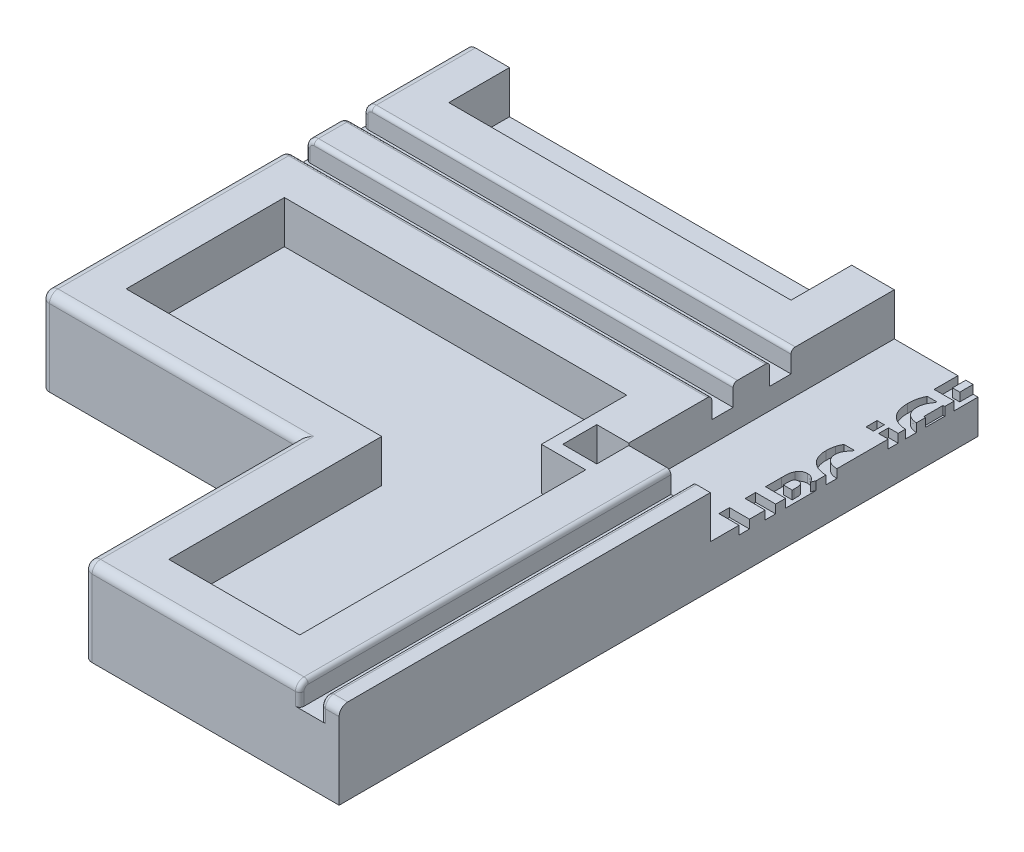
from build123d import *

# Parameters (mm, degrees)
SKETCH1_W                                  = 240
SKETCH1_H                                  = 200
BOSS_EXTRUDE1_DEPTH                        = 20
SKETCH7_W                                  = 120
SKETCH7_H                                  = 50
BOSS_EXTRUDE6_DEPTH                        = 20
FILLET1_R                                  = 2
SKETCH2_W                                  = 39.3
SKETCH2_H                                  = 125.7
CUT_EXTRUDE1_DEPTH                         = 10
CUT_EXTRUDE3_DEPTH                         = 5
MIRROR4_AT_THE_SECOND_PLANE_COPY_1_DEPTH   = 5
SKETCH11_W                                 = 104.748042719
SKETCH11_H                                 = 5
CUT_EXTRUDE4_DEPTH                         = 5
MIRROR6_AT_THE_SECOND_PLANE_COPY_1_SKETC_W = 104.748042719
MIRROR6_AT_THE_SECOND_PLANE_COPY_1_SKETC_H = 5
MIRROR6_AT_THE_SECOND_PLANE_COPY_1_DEPTH   = 5
SHELL1_START                               = 10
SHELL1_OUTLINE_W                           = 80.35
SHELL1_OUTLINE_H                           = 28.5
SHELL1_DEPTH                               = 10
FILLET3_R                                  = 1
SKETCH13_W                                 = 7.252545243
SKETCH13_H                                 = 2.335565418
SKETCH13_W_2                               = 1.720942939
SKETCH13_H_2                               = 2.581414408
CUT_EXTRUDE5_DEPTH                         = 2
CUT_EXTRUDE6_DEPTH                         = 10
MIRROR7_AT_THE_SECOND_PLANE_COPY_1_DEPTH   = 10
SKETCH15_W                                 = 252.845295914
SKETCH15_H                                 = 31.352816693
CUT_EXTRUDE7_DEPTH                         = 194.132079158
SKETCH16_W                                 = 164.349442344
SKETCH16_H                                 = 29.07720903
CUT_EXTRUDE8_DEPTH                         = 194.132079158


# Read off the part's stored shape, not the designer's step: Shell1
with BuildPart() as part:
    # Sketch1 → Boss-Extrude1 (new body)
    with BuildSketch(Plane(origin=(0, 0, 0), x_dir=(1, 0, 0), z_dir=(0, 1, 0))):
        Rectangle(SKETCH1_W, SKETCH1_H)
    extrude(amount=BOSS_EXTRUDE1_DEPTH)

    # Sketch7 → Boss-Extrude6 (add)
    with BuildSketch(Plane(origin=(0, 0, 0), x_dir=(1, 0, 0), z_dir=(0, 1, 0))):
        with Locations((0, 125)):
            Rectangle(SKETCH7_W, SKETCH7_H)
        with Locations((0, -125)):
            Rectangle(SKETCH7_W, SKETCH7_H)
    extrude(amount=BOSS_EXTRUDE6_DEPTH)

    # Fillet1
    fillet1_edges = [part.edges().sort_by_distance(p)[0] for p in [
        (-120, 20, 0),
        (90, 20, 100),
        (-90, 20, 100),
        (-60, 10, 150),
        (60, 10, 150),
        (-60, 20, 125),
        (0, 20, 150),
        (60, 20, 125),
        (-90, 20, -100),
        (60, 20, -125),
        (0, 20, -150),
        (60, 10, -150),
        (-60, 10, -150),
        (-60, 20, -125),
        (120, 20, 0),
        (120, 10, 100),
        (-120, 10, 100),
        (-120, 10, -100),
        (120, 10, -100),
        (90, 20, -100),
    ]]
    fillet(fillet1_edges, radius=FILLET1_R)

    # Sketch2 → Cut-Extrude1 (cut)
    with BuildSketch(Plane(origin=(0, 20, 0), x_dir=(1, 0, 0), z_dir=(0, 1, 0))):
        Rectangle(SKETCH2_W, SKETCH2_H)
    extrude(amount=-CUT_EXTRUDE1_DEPTH, mode=Mode.SUBTRACT)

    # Sketch10 → Cut-Extrude3 (cut)
    with BuildSketch(Plane(origin=(0, 20, 0), x_dir=(1, 0, 0), z_dir=(0, 1, 0))):
        Polygon((-9.25, -40.5), (-9.25, -33.162899401), (-4.25, -33.162899401), (-4.25, -40.5), (-4.25, -156.832928994), (-9.25, -156.832928994), align=None)
    cut_extrude3 = extrude(amount=-CUT_EXTRUDE3_DEPTH, mode=Mode.SUBTRACT)

    # Mirror4: Cut-Extrude3 across plane
    add(cut_extrude3.mirror(Plane(origin=(0, 0, 0), x_dir=(0, 0, 1), z_dir=(1, 0, 0))), mode=Mode.SUBTRACT)

    # Mirror4 at the second plane: Cut-Extrude3 across plane
    add(cut_extrude3.mirror(Plane.XY), mode=Mode.SUBTRACT)

    # Mirror4 at the second plane copy 1 sketc → Mirror4 at the second plane copy 1 (cut)
    with BuildSketch(Plane(origin=(0, 20, 0), x_dir=(-1, 0, 0), z_dir=(0, 1, 0))):
        Polygon((-9.25, -40.5), (-9.25, -33.162899401), (-4.25, -33.162899401), (-4.25, -40.5), (-4.25, -156.832928994), (-9.25, -156.832928994), align=None)
    extrude(amount=-MIRROR4_AT_THE_SECOND_PLANE_COPY_1_DEPTH, mode=Mode.SUBTRACT)

    # Sketch11 → Cut-Extrude4 (cut)
    with BuildSketch(Plane(origin=(0, 20, 0), x_dir=(1, 0, 0), z_dir=(0, 1, 0))):
        with Locations((-72.024021359, 26.75)):
            Rectangle(SKETCH11_W, SKETCH11_H)
        with Locations((-72.024021359, 40.35)):
            Rectangle(SKETCH11_W, SKETCH11_H)
    cut_extrude4 = extrude(amount=-CUT_EXTRUDE4_DEPTH, mode=Mode.SUBTRACT)

    # Mirror6: Cut-Extrude4 across plane
    add(cut_extrude4.mirror(Plane.XY), mode=Mode.SUBTRACT)

    # Mirror6 at the second plane: Cut-Extrude4 across plane
    add(cut_extrude4.mirror(Plane(origin=(0, 0, 0), x_dir=(0, 0, 1), z_dir=(1, 0, 0))), mode=Mode.SUBTRACT)

    # Mirror6 at the second plane copy 1 sketc → Mirror6 at the second plane copy 1 (cut)
    with BuildSketch(Plane(origin=(0, 20, 0), x_dir=(-1, 0, 0), z_dir=(0, 1, 0))):
        with Locations((-72.024021359, 26.75)):
            Rectangle(MIRROR6_AT_THE_SECOND_PLANE_COPY_1_SKETC_W, MIRROR6_AT_THE_SECOND_PLANE_COPY_1_SKETC_H)
        with Locations((-72.024021359, 40.35)):
            Rectangle(MIRROR6_AT_THE_SECOND_PLANE_COPY_1_SKETC_W, MIRROR6_AT_THE_SECOND_PLANE_COPY_1_SKETC_H)
    extrude(amount=-MIRROR6_AT_THE_SECOND_PLANE_COPY_1_DEPTH, mode=Mode.SUBTRACT)

    # Shell1 outline → Shell1 (cut)
    with BuildSketch(Plane(origin=(0, 0, 0), x_dir=(1, 0, 0), z_dir=(0, 1, 0)).offset(SHELL1_START)):
        Polygon((-29.65, 72.85), (-19.25, 72.85), (-19.25, 140), (-50, 140), (-50, 90), (-110, 90), (-110, 52.85), (-29.65, 52.85), align=None)
        Polygon((19.25, 72.85), (29.65, 72.85), (29.65, 52.85), (110, 52.85), (110, 90), (50, 90), (50, 140), (19.25, 140), align=None)
        Polygon((-110, -52.85), (-110, -90), (-50, -90), (-50, -140), (-19.25, -140), (-19.25, -72.85), (-29.65, -72.85), (-29.65, -52.85), align=None)
        with Locations((-69.825, 0)):
            Rectangle(SHELL1_OUTLINE_W, SHELL1_OUTLINE_H)
        Polygon((29.65, -72.85), (19.25, -72.85), (19.25, -140), (50, -140), (50, -90), (110, -90), (110, -52.85), (29.65, -52.85), align=None)
        with Locations((69.825, 0)):
            Rectangle(SHELL1_OUTLINE_W, SHELL1_OUTLINE_H)
    extrude(amount=SHELL1_DEPTH, mode=Mode.SUBTRACT)

    # Fillet3
    fillet3_edges = [part.edges().sort_by_distance(p)[0] for p in [
        (-4.25, 16.5, 150),
        (-4.25, 19.414213562, 149.414213562),
        (-9.25, 16.5, 150),
        (-9.25, 19.414213562, 149.414213562),
        (-4.25, 20, 105.425),
        (-9.25, 20, 105.425),
        (-9.25, 19.414213562, -149.414213562),
        (-9.25, 16.5, -150),
        (-9.25, 20, -105.425),
        (-4.25, 16.5, -150),
        (-4.25, 19.414213562, -149.414213562),
        (-4.25, 20, -105.425),
        (9.25, 16.5, 150),
        (9.25, 20, 105.425),
        (9.25, 19.414213562, 149.414213562),
        (4.25, 16.5, 150),
        (4.25, 19.414213562, 149.414213562),
        (4.25, 20, 105.425),
        (4.25, 16.5, -150),
        (4.25, 19.414213562, -149.414213562),
        (9.25, 19.414213562, -149.414213562),
        (9.25, 16.5, -150),
        (4.25, 20, -105.425),
        (9.25, 20, -105.425),
        (-120, 16.5, -24.25),
        (-120, 16.5, -29.25),
        (-119.414213562, 19.414213562, -24.25),
        (-119.414213562, 19.414213562, -29.25),
        (-68.825, 20, -24.25),
        (-68.825, 20, -29.25),
        (-120, 16.5, -37.85),
        (-120, 16.5, -42.85),
        (-68.825, 20, -37.85),
        (-68.825, 20, -42.85),
        (-119.414213562, 19.414213562, -37.85),
        (-119.414213562, 19.414213562, -42.85),
        (68.825, 20, -29.25),
        (119.414213562, 19.414213562, -29.25),
        (119.414213562, 19.414213562, -24.25),
        (68.825, 20, -24.25),
        (120, 16.5, -29.25),
        (120, 16.5, -24.25),
        (68.825, 20, -42.85),
        (119.414213562, 19.414213562, -42.85),
        (119.414213562, 19.414213562, -37.85),
        (68.825, 20, -37.85),
        (120, 16.5, -42.85),
        (120, 16.5, -37.85),
        (-120, 16.5, 29.25),
        (-120, 16.5, 24.25),
        (-68.825, 20, 29.25),
        (-119.414213562, 19.414213562, 29.25),
        (-119.414213562, 19.414213562, 24.25),
        (-68.825, 20, 24.25),
        (-120, 16.5, 42.85),
        (-120, 16.5, 37.85),
        (-68.825, 20, 42.85),
        (-119.414213562, 19.414213562, 42.85),
        (-119.414213562, 19.414213562, 37.85),
        (-68.825, 20, 37.85),
        (120, 16.5, 24.25),
        (120, 16.5, 29.25),
        (119.414213562, 19.414213562, 24.25),
        (119.414213562, 19.414213562, 29.25),
        (68.825, 20, 24.25),
        (68.825, 20, 29.25),
        (120, 16.5, 37.85),
        (120, 16.5, 42.85),
        (68.825, 20, 37.85),
        (68.825, 20, 42.85),
        (119.414213562, 19.414213562, 37.85),
        (119.414213562, 19.414213562, 42.85),
    ]]
    fillet(fillet3_edges, radius=FILLET3_R)

    # Sketch13 → Cut-Extrude5 (cut)
    # profile 1 of 12: a face of its own
    with BuildSketch(Plane(origin=(0, 10, 0), x_dir=(1, 0, 0), z_dir=(0, 1, 0))):
        Polygon((2.787359078, 56.729654742), (2.787359078, 55.37748529), (5, 55.37748529), (5, 53.041919872), (2.787359078, 53.041919872), (2.787359078, 48.247864542), (0.880108701, 48.247864542), (-4.711035156, 52.886343558), (-4.711035156, 55.37748529), (0.943491644, 55.37748529), (0.943491644, 56.729654742), align=None)
        Polygon((0.943491644, 53.041919872), (-2.596349692, 53.041919872), (0.943491644, 50.110938929), align=None, mode=Mode.SUBTRACT)
    # profile 2 of 12: a face of its own
    with BuildSketch(Plane(origin=(0, 10, 0), x_dir=(1, 0, 0), z_dir=(0, 1, 0))):
        with BuildLine():
            Line((5, 47.141544081), (5, 39.520225351))
            Line((5, 39.520225351), (3.409664338, 39.520225351))
            add(Edge.make_bspline(
                [(3.409664338, 39.520225351), (3.190599668, 39.81675512), (2.747057383, 40.417141716), (2.167094132, 41.14339637), (1.704390868, 41.703253096), (1.381972101, 42.083056551), (1.083256561, 42.417759603), (0.887687077, 42.622007507), (0.79559811, 42.718182933)],
                knots=[0, 0, 0, 0, 1.605452287, 3.25057426, 4.046675402, 4.768563423, 5.420146126, 6, 6, 6, 6], degree=3))
            add(Edge.make_bspline(
                [(0.79559811, 42.718182933), (0.732570292, 42.782561984), (0.609352585, 42.908421315), (0.423765416, 43.085974145), (0.244476812, 43.249198615), (0.074088064, 43.400664381), (-0.092796487, 43.534082219), (-0.252790737, 43.654099684), (-0.406497488, 43.759962438), (-0.599845109, 43.881290453), (-0.837875375, 44.00401532), (-1.125540586, 44.112139625), (-1.412736444, 44.178491494), (-1.604945873, 44.187117789), (-1.699385013, 44.191356186)],
                knots=[0, 0, 0, 0, 1.090093853, 2.131104457, 3.107135244, 4.023908394, 4.888948297, 5.691514549, 6.4435893, 7.146498757, 8.452673016, 9.675803408, 10.85804184, 12, 12, 12, 12], degree=3))
            add(Edge.make_bspline(
                [(-1.699385013, 44.191356186), (-1.754483363, 44.189605987), (-1.861179083, 44.186216799), (-2.017224671, 44.167846758), (-2.162681909, 44.132103765), (-2.300488192, 44.087839319), (-2.42643972, 44.024206924), (-2.544199113, 43.950411254), (-2.650531499, 43.859818439), (-2.749307162, 43.758726543), (-2.834556733, 43.642742478), (-2.911599654, 43.517157005), (-2.971430142, 43.377241787), (-3.024398474, 43.226819474), (-3.063653395, 43.063897589), (-3.092633036, 42.889340485), (-3.109905835, 42.703165878), (-3.111960528, 42.574807759), (-3.113016713, 42.508827152)],
                knots=[0, 0, 0, 0, 1.058578686, 2.049894692, 3.010224385, 3.931750511, 4.822578239, 5.71281177, 6.594427321, 7.498813824, 8.420995957, 9.353043897, 10.321837571, 11.3367408, 12.413304787, 13.535187771, 14.732999458, 16, 16, 16, 16], degree=3))
            add(Edge.make_bspline(
                [(-3.113016713, 42.508827152), (-3.110052719, 42.405568465), (-3.104041103, 42.196137688), (-3.053985994, 41.878413923), (-2.980602684, 41.552282773), (-2.873221808, 41.222921491), (-2.74714341, 40.895094854), (-2.596251992, 40.578640505), (-2.438170844, 40.269132893), (-2.314289691, 40.074405983), (-2.252545243, 39.977350819)],
                knots=[0, 0, 0, 0, 0.914703558, 1.855215137, 2.844920106, 3.875005138, 4.922433174, 5.955639304, 6.981056277, 8, 8, 8, 8], degree=3))
            Line((-2.252545243, 39.977350819), (-2.252545243, 39.766074342))
            Line((-2.252545243, 39.766074342), (-4.363389317, 39.766074342))
            add(Edge.make_bspline(
                [(-4.363389317, 39.766074342), (-4.396975153, 39.85152697), (-4.470639347, 40.038951181), (-4.568658946, 40.352153969), (-4.66491051, 40.720660415), (-4.763825821, 41.132864511), (-4.849735205, 41.573321973), (-4.910075419, 42.024211578), (-4.95119256, 42.474770211), (-4.954991729, 42.775713815), (-4.956884148, 42.92561802)],
                knots=[0, 0, 0, 0, 0.681686624, 1.495150967, 2.435076171, 3.509887788, 4.642826517, 5.765734475, 6.887081194, 8, 8, 8, 8], degree=3))
            add(Edge.make_bspline(
                [(-4.956884148, 42.92561802), (-4.954912362, 43.072306092), (-4.951074185, 43.357841566), (-4.914531776, 43.772464491), (-4.853049644, 44.160650299), (-4.769612134, 44.521836328), (-4.662431161, 44.856562797), (-4.529987596, 45.163893905), (-4.371768891, 45.443672956), (-4.191325, 45.69718541), (-3.986517109, 45.920499957), (-3.762299213, 46.116633841), (-3.516918106, 46.283180062), (-3.250583577, 46.417510178), (-2.964907945, 46.521931142), (-2.659732708, 46.596780352), (-2.333869778, 46.641015432), (-2.109911454, 46.646854566), (-1.995172081, 46.649846099)],
                knots=[0, 0, 0, 0, 1.302669921, 2.535710425, 3.693104205, 4.791067539, 5.825099944, 6.810730835, 7.758000335, 8.67487823, 9.568447078, 10.443087854, 11.315285082, 12.19521531, 13.085757283, 14.011200708, 14.981089066, 16, 16, 16, 16], degree=3))
            add(Edge.make_bspline(
                [(-1.995172081, 46.649846099), (-1.918295051, 46.648245135), (-1.764899121, 46.645050664), (-1.536586701, 46.623146341), (-1.311198259, 46.589276583), (-1.089189633, 46.538876948), (-0.870129482, 46.472993238), (-0.653296175, 46.39436831), (-0.439122967, 46.302496277), (-0.229338943, 46.193054838), (-0.018163961, 46.072147599), (0.191952814, 45.932794317), (0.405837655, 45.781094454), (0.620958688, 45.614342324), (0.835471411, 45.430057751), (1.055741697, 45.23549192), (1.273520634, 45.021368665), (1.417594688, 44.872241147), (1.490889788, 44.796375188)],
                knots=[0, 0, 0, 0, 0.907170522, 1.810115022, 2.704515666, 3.595334857, 4.494160497, 5.402400165, 6.316123003, 7.242010315, 8.19323076, 9.186549597, 10.215937183, 11.28746875, 12.397107329, 13.552885457, 14.755074217, 16, 16, 16, 16], degree=3))
            add(Edge.make_bspline(
                [(1.490889788, 44.796375188), (1.669671754, 44.600991906), (2.021428479, 44.216571794), (2.422503942, 43.720261203), (2.710127438, 43.347225494), (2.892573427, 43.11547907), (3.035611297, 42.923413887), (3.11966375, 42.809753418), (3.156132565, 42.760438229)],
                knots=[0, 0, 0, 0, 1.811045763, 3.563265038, 4.362127914, 5.033096026, 5.580478129, 6, 6, 6, 6], degree=3))
            Line((3.156132565, 42.760438229), (3.156132565, 47.141544081))
            Line((3.156132565, 47.141544081), (5, 47.141544081))
        make_face()
    # profile 3 of 12: a face of its own
    with BuildSketch(Plane(origin=(0, 10, 0), x_dir=(1, 0, 0), z_dir=(0, 1, 0))):
        with BuildLine():
            add(Edge.make_bspline(
                [(0.138720336, 37.553433421), (0.339837036, 37.551198694), (0.731017162, 37.546852061), (1.301575539, 37.503210957), (1.839727263, 37.435290008), (2.344336806, 37.340402007), (2.812295891, 37.218717557), (3.235819492, 37.059739443), (3.620265586, 36.877229499), (3.845547684, 36.720963882), (3.955141787, 36.64494457)],
                knots=[0, 0, 0, 0, 1.210994604, 2.355433537, 3.443919748, 4.476135166, 5.446013627, 6.351277171, 7.197937607, 8, 8, 8, 8], degree=3))
            add(Edge.make_bspline(
                [(3.955141787, 36.64494457), (4.057367971, 36.5617232), (4.260610648, 36.396265258), (4.524020765, 36.101981434), (4.745368417, 35.772676286), (4.897303004, 35.472877401), (4.999247268, 35.217133399), (5.063592063, 35.011802969), (5.122267484, 34.796985151), (5.167723638, 34.570405454), (5.201934481, 34.333084121), (5.226664862, 34.085073274), (5.242295446, 33.825562266), (5.244648027, 33.648682389), (5.245848991, 33.558387312)],
                knots=[0, 0, 0, 0, 1.363120718, 2.710110989, 4.070537742, 5.460816644, 6.180869889, 6.918733188, 7.687278466, 8.485437086, 9.309407483, 10.168795045, 11.065191617, 12, 12, 12, 12], degree=3))
            add(Edge.make_bspline(
                [(5.245848991, 33.558387312), (5.241905689, 33.384062955), (5.234297073, 33.047703496), (5.173081199, 32.562988904), (5.069699732, 32.118069919), (4.926806373, 31.711596248), (4.739854178, 31.34454147), (4.516760058, 31.013155063), (4.251279595, 30.717979546), (4.045332533, 30.554230832), (3.94169692, 30.471830054)],
                knots=[0, 0, 0, 0, 1.200851745, 2.317047666, 3.359233085, 4.342911255, 5.278031965, 6.189548012, 7.088953741, 8, 8, 8, 8], degree=3))
            add(Edge.make_bspline(
                [(3.94169692, 30.471830054), (3.829424185, 30.3947628), (3.600170882, 30.2373967), (3.214838014, 30.049115343), (2.792701976, 29.89168932), (2.331256748, 29.768085058), (1.834031119, 29.675388633), (1.301418942, 29.61187027), (0.734794995, 29.570336966), (0.344952566, 29.565716964), (0.144482422, 29.563341204)],
                knots=[0, 0, 0, 0, 0.822750793, 1.680001256, 2.58557045, 3.544707477, 4.565467581, 5.642347189, 6.787615291, 8, 8, 8, 8], degree=3))
            add(Edge.make_bspline(
                [(0.144482422, 29.563341204), (-0.061754837, 29.565532126), (-0.459970452, 29.569762495), (-1.036345286, 29.613069323), (-1.570746564, 29.680774054), (-2.065452333, 29.775711056), (-2.521358164, 29.900947264), (-2.938473361, 30.06222162), (-3.323134476, 30.249194002), (-3.55325365, 30.406272972), (-3.666176943, 30.483354226)],
                knots=[0, 0, 0, 0, 1.242237956, 2.39858964, 3.479780431, 4.485821505, 5.430991799, 6.32348679, 7.177307181, 8, 8, 8, 8], degree=3))
            add(Edge.make_bspline(
                [(-3.666176943, 30.483354226), (-3.769193286, 30.566416838), (-3.974708441, 30.732124775), (-4.238285133, 31.029639616), (-4.461065672, 31.362253167), (-4.645070962, 31.729678272), (-4.784115122, 32.135791847), (-4.885860052, 32.577168574), (-4.944671996, 33.056148657), (-4.952723667, 33.387282789), (-4.956884148, 33.558387312)],
                knots=[0, 0, 0, 0, 0.915406887, 1.826214983, 2.74012738, 3.682217607, 4.664024873, 5.706462388, 6.814877053, 8, 8, 8, 8], degree=3))
            add(Edge.make_bspline(
                [(-4.956884148, 33.558387312), (-4.955682618, 33.64868302), (-4.953320425, 33.826203271), (-4.937576888, 34.086978277), (-4.913381513, 34.337057391), (-4.877300412, 34.575699285), (-4.828262853, 34.80214551), (-4.773499009, 35.018778584), (-4.706561244, 35.224310597), (-4.601886899, 35.480626422), (-4.447267393, 35.781827029), (-4.217150947, 36.109134402), (-3.948246131, 36.405401156), (-3.739143401, 36.569659884), (-3.633525124, 36.652627351)],
                knots=[0, 0, 0, 0, 0.927772364, 1.823989051, 2.683453821, 3.508702832, 4.302191287, 5.063276402, 5.803871599, 6.520953588, 7.906777029, 9.27188215, 10.622021304, 12, 12, 12, 12], degree=3))
            add(Edge.make_bspline(
                [(-3.633525124, 36.652627351), (-3.521300204, 36.729189524), (-3.292789343, 36.885084383), (-2.908970475, 37.068290297), (-2.492360426, 37.225455121), (-2.036263275, 37.346342452), (-1.54437137, 37.439204828), (-1.015826808, 37.505677425), (-0.450933502, 37.546286922), (-0.061742996, 37.551003841), (0.138720336, 37.553433421)],
                knots=[0, 0, 0, 0, 0.826423845, 1.682753026, 2.582377666, 3.535958882, 4.552416628, 5.629628825, 6.779074777, 8, 8, 8, 8], degree=3))
        make_face()
        with BuildLine():
            add(Edge.make_bspline(
                [(0.138720336, 35.094943508), (-0.002794049, 35.093990238), (-0.275052116, 35.092156251), (-0.667644343, 35.074004214), (-1.028464631, 35.048543297), (-1.357952356, 35.010483072), (-1.656192237, 34.961169576), (-1.923473104, 34.900935006), (-2.158488294, 34.828227196), (-2.363936988, 34.745989678), (-2.54162794, 34.64913888), (-2.69467252, 34.537908006), (-2.823572221, 34.410664927), (-2.931286275, 34.270097317), (-3.011274034, 34.111739825), (-3.072443859, 33.941187009), (-3.106785969, 33.754382189), (-3.110895684, 33.625106618), (-3.113016713, 33.558387312)],
                knots=[0, 0, 0, 0, 1.684598718, 3.240982106, 4.677870026, 5.990101975, 7.188004416, 8.275163324, 9.249099904, 10.113910365, 10.905306099, 11.652292794, 12.358339015, 13.054983843, 13.750418457, 14.461547751, 15.206002611, 16, 16, 16, 16], degree=3))
            add(Edge.make_bspline(
                [(-3.113016713, 33.558387312), (-3.110895681, 33.491668012), (-3.106785962, 33.362392453), (-3.072443884, 33.175587552), (-3.011273943, 33.005035023), (-2.931286606, 32.84667649), (-2.823570979, 32.706112772), (-2.694677343, 32.578854684), (-2.541608299, 32.467684345), (-2.363496496, 32.37029911), (-2.157013742, 32.289020864), (-1.921590867, 32.215742751), (-1.654258135, 32.155647372), (-1.355414385, 32.106122047), (-1.024612933, 32.068276855), (-0.661244964, 32.04269777), (-0.266085327, 32.024665897), (0.008090715, 32.022799039), (0.150244508, 32.021831116)],
                knots=[0, 0, 0, 0, 0.791766581, 1.534129826, 2.243261137, 2.936741863, 3.631429404, 4.335491923, 5.08037989, 5.869552125, 6.738971147, 7.710171362, 8.794275798, 9.988812621, 11.304907075, 12.745337551, 14.312534512, 16, 16, 16, 16], degree=3))
            add(Edge.make_bspline(
                [(0.150244508, 32.021831116), (0.289201434, 32.022765136), (0.556986265, 32.024565091), (0.943773412, 32.043063349), (1.30096878, 32.067483158), (1.627502144, 32.109075315), (1.924420257, 32.156514098), (2.190195476, 32.220950105), (2.427221865, 32.292197549), (2.635687527, 32.376524358), (2.816464841, 32.475577579), (2.974492505, 32.586386469), (3.106149375, 32.714997304), (3.215613674, 32.855867424), (3.298888327, 33.012083539), (3.358752163, 33.181622444), (3.396338685, 33.365314373), (3.400067537, 33.492898418), (3.401981557, 33.558387312)],
                knots=[0, 0, 0, 0, 1.658832269, 3.196746878, 4.622488866, 5.931787449, 7.125569234, 8.210133994, 9.194149195, 10.078471196, 10.889203548, 11.650697572, 12.375032472, 13.07829054, 13.77251817, 14.478471121, 15.218999177, 16, 16, 16, 16], degree=3))
            add(Edge.make_bspline(
                [(3.401981557, 33.558387312), (3.400068186, 33.623876875), (3.3963406, 33.751462223), (3.358745104, 33.935144911), (3.298913291, 34.10471679), (3.215521541, 34.260812329), (3.106775331, 34.40178813), (2.97377315, 34.528364287), (2.816557237, 34.639341559), (2.635707586, 34.738476019), (2.42683161, 34.821967534), (2.190341985, 34.897522561), (1.921851262, 34.956560743), (1.624132619, 35.009519497), (1.295502071, 35.045529443), (0.936895825, 35.074962985), (0.547988509, 35.091838226), (0.278306115, 35.093884415), (0.138720336, 35.094943508)],
                knots=[0, 0, 0, 0, 0.778971247, 1.517574904, 2.221693305, 2.914116855, 3.615547377, 4.332711038, 5.092226179, 5.900851692, 6.782875619, 7.766611013, 8.854037796, 10.053520173, 11.366075456, 12.788704916, 14.337855446, 16, 16, 16, 16], degree=3))
        make_face(mode=Mode.SUBTRACT)
    # profile 4 of 12: a face of its own
    with BuildSketch(Plane(origin=(0, 10, 0), x_dir=(1, 0, 0), z_dir=(0, 1, 0))):
        with BuildLine():
            Line((5, 28.211171751), (5, 20.589853021))
            Line((5, 20.589853021), (3.409664338, 20.589853021))
            add(Edge.make_bspline(
                [(3.409664338, 20.589853021), (3.190599668, 20.88638279), (2.747057383, 21.486769386), (2.167094132, 22.21302404), (1.704390868, 22.772880767), (1.381972101, 23.152684221), (1.083256561, 23.487387273), (0.887687077, 23.691635177), (0.79559811, 23.787810603)],
                knots=[0, 0, 0, 0, 1.605452287, 3.25057426, 4.046675402, 4.768563423, 5.420146126, 6, 6, 6, 6], degree=3))
            add(Edge.make_bspline(
                [(0.79559811, 23.787810603), (0.732570292, 23.852189654), (0.609352585, 23.978048985), (0.423765416, 24.155601815), (0.244476812, 24.318826285), (0.074088064, 24.470292051), (-0.092796487, 24.60370989), (-0.252790737, 24.723727355), (-0.406497488, 24.829590108), (-0.599845109, 24.950918123), (-0.837875375, 25.07364299), (-1.125540586, 25.181767295), (-1.412736444, 25.248119164), (-1.604945873, 25.256745459), (-1.699385013, 25.260983856)],
                knots=[0, 0, 0, 0, 1.090093853, 2.131104457, 3.107135244, 4.023908394, 4.888948297, 5.691514549, 6.4435893, 7.146498757, 8.452673016, 9.675803408, 10.85804184, 12, 12, 12, 12], degree=3))
            add(Edge.make_bspline(
                [(-1.699385013, 25.260983856), (-1.754483363, 25.259233658), (-1.861179083, 25.25584447), (-2.017224671, 25.237474428), (-2.162681909, 25.201731435), (-2.300488192, 25.157466989), (-2.42643972, 25.093834595), (-2.544199113, 25.020038924), (-2.650531499, 24.929446109), (-2.749307162, 24.828354213), (-2.834556733, 24.712370148), (-2.911599654, 24.586784675), (-2.971430142, 24.446869457), (-3.024398474, 24.296447144), (-3.063653395, 24.133525259), (-3.092633036, 23.958968155), (-3.109905835, 23.772793548), (-3.111960528, 23.644435429), (-3.113016713, 23.578454822)],
                knots=[0, 0, 0, 0, 1.058578686, 2.049894692, 3.010224385, 3.931750511, 4.822578239, 5.71281177, 6.594427321, 7.498813824, 8.420995957, 9.353043897, 10.321837571, 11.3367408, 12.413304787, 13.535187771, 14.732999458, 16, 16, 16, 16], degree=3))
            add(Edge.make_bspline(
                [(-3.113016713, 23.578454822), (-3.110052719, 23.475196136), (-3.104041103, 23.265765358), (-3.053985994, 22.948041593), (-2.980602684, 22.621910443), (-2.873221808, 22.292549161), (-2.74714341, 21.964722525), (-2.596251992, 21.648268175), (-2.438170844, 21.338760563), (-2.314289691, 21.144033653), (-2.252545243, 21.046978489)],
                knots=[0, 0, 0, 0, 0.914703558, 1.855215137, 2.844920106, 3.875005138, 4.922433174, 5.955639304, 6.981056277, 8, 8, 8, 8], degree=3))
            Line((-2.252545243, 21.046978489), (-2.252545243, 20.835702012))
            Line((-2.252545243, 20.835702012), (-4.363389317, 20.835702012))
            add(Edge.make_bspline(
                [(-4.363389317, 20.835702012), (-4.396975153, 20.92115464), (-4.470639347, 21.108578851), (-4.568658946, 21.421781639), (-4.66491051, 21.790288086), (-4.763825821, 22.202492181), (-4.849735205, 22.642949643), (-4.910075419, 23.093839248), (-4.95119256, 23.544397881), (-4.954991729, 23.845341485), (-4.956884148, 23.99524569)],
                knots=[0, 0, 0, 0, 0.681686624, 1.495150967, 2.435076171, 3.509887788, 4.642826517, 5.765734475, 6.887081194, 8, 8, 8, 8], degree=3))
            add(Edge.make_bspline(
                [(-4.956884148, 23.99524569), (-4.954912362, 24.141933762), (-4.951074185, 24.427469237), (-4.914531776, 24.842092162), (-4.853049644, 25.230277969), (-4.769612134, 25.591463998), (-4.662431161, 25.926190468), (-4.529987596, 26.233521576), (-4.371768891, 26.513300626), (-4.191325, 26.76681308), (-3.986517109, 26.990127627), (-3.762299213, 27.186261512), (-3.516918106, 27.352807733), (-3.250583577, 27.487137848), (-2.964907945, 27.591558812), (-2.659732708, 27.666408023), (-2.333869778, 27.710643103), (-2.109911454, 27.716482236), (-1.995172081, 27.719473769)],
                knots=[0, 0, 0, 0, 1.302669921, 2.535710425, 3.693104205, 4.791067539, 5.825099944, 6.810730835, 7.758000335, 8.67487823, 9.568447078, 10.443087854, 11.315285082, 12.19521531, 13.085757283, 14.011200708, 14.981089066, 16, 16, 16, 16], degree=3))
            add(Edge.make_bspline(
                [(-1.995172081, 27.719473769), (-1.918295051, 27.717872805), (-1.764899121, 27.714678334), (-1.536586701, 27.692774011), (-1.311198259, 27.658904253), (-1.089189633, 27.608504619), (-0.870129482, 27.542620908), (-0.653296175, 27.46399598), (-0.439122967, 27.372123947), (-0.229338943, 27.262682508), (-0.018163961, 27.141775269), (0.191952814, 27.002421987), (0.405837655, 26.850722124), (0.620958688, 26.683969994), (0.835471411, 26.499685422), (1.055741697, 26.30511959), (1.273520634, 26.090996335), (1.417594688, 25.941868817), (1.490889788, 25.866002858)],
                knots=[0, 0, 0, 0, 0.907170522, 1.810115022, 2.704515666, 3.595334857, 4.494160497, 5.402400165, 6.316123003, 7.242010315, 8.19323076, 9.186549597, 10.215937183, 11.28746875, 12.397107329, 13.552885457, 14.755074217, 16, 16, 16, 16], degree=3))
            add(Edge.make_bspline(
                [(1.490889788, 25.866002858), (1.669671754, 25.670619576), (2.021428479, 25.286199464), (2.422503942, 24.789888873), (2.710127438, 24.416853164), (2.892573427, 24.18510674), (3.035611297, 23.993041557), (3.11966375, 23.879381088), (3.156132565, 23.830065899)],
                knots=[0, 0, 0, 0, 1.811045763, 3.563265038, 4.362127914, 5.033096026, 5.580478129, 6, 6, 6, 6], degree=3))
            Line((3.156132565, 23.830065899), (3.156132565, 28.211171751))
            Line((3.156132565, 28.211171751), (5, 28.211171751))
        make_face()
    # profile 5 of 12: a face of its own
    with BuildSketch(Plane(origin=(0, 10, 0), x_dir=(1, 0, 0), z_dir=(0, 1, 0))):
        Polygon((5, 13.583156769), (5, 11.124666856), (-1.524601746, 11.124666856), (2.664434583, 9.338420279), (2.664434583, 7.625160121), (-1.524601746, 5.838913543), (5, 5.838913543), (5, 3.503348126), (-4.711035156, 3.503348126), (-4.711035156, 6.382470298), (0.125275469, 8.549014533), (-4.711035156, 10.709796683), (-4.711035156, 13.583156769), align=None)
    # profile 6 of 12: a face of its own
    with BuildSketch(Plane(origin=(0, 10, 0), x_dir=(1, 0, 0), z_dir=(0, 1, 0))):
        Polygon((5, 1.4136317), (5, -5.593064552), (-4.711035156, -5.593064552), (-4.711035156, 1.4136317), (-2.867167722, 1.4136317), (-2.867167722, -3.134574639), (-1.146224782, -3.134574639), (-1.146224782, 1.044858213), (0.697642652, 1.044858213), (0.697642652, -3.134574639), (3.156132565, -3.134574639), (3.156132565, 1.4136317), align=None)
    # profile 7 of 12: a face of its own
    with BuildSketch(Plane(origin=(0, 10, 0), x_dir=(1, 0, 0), z_dir=(0, 1, 0))):
        with BuildLine():
            add(Edge.make_bspline(
                [(4.475650198, -7.805705474), (4.519354839, -7.923859504), (4.612512661, -8.17570855), (4.743574124, -8.583890089), (4.866671289, -9.047274178), (4.996208031, -9.552124696), (5.106381276, -10.084227717), (5.187397941, -10.625264318), (5.237323662, -11.165972628), (5.243010567, -11.526628491), (5.245848991, -11.706637515)],
                knots=[0, 0, 0, 0, 0.756485239, 1.612472169, 2.573171414, 3.635272123, 4.742182008, 5.834553763, 6.919191659, 8, 8, 8, 8], degree=3))
            add(Edge.make_bspline(
                [(5.245848991, -11.706637515), (5.241962961, -11.909112321), (5.234392087, -12.303579456), (5.17063924, -12.878829296), (5.062937634, -13.419584917), (4.916847086, -13.928231287), (4.72267015, -14.400885619), (4.491042888, -14.842463027), (4.211679163, -15.247896521), (3.893490591, -15.618759753), (3.53655883, -15.9505899), (3.145758166, -16.239699566), (2.72146993, -16.48347792), (2.264846611, -16.681095463), (1.776896349, -16.838089964), (1.255150105, -16.944841813), (0.702111097, -17.014888699), (0.322052776, -17.021601157), (0.127196165, -17.025042647)],
                knots=[0, 0, 0, 0, 1.160705024, 2.261318311, 3.313123859, 4.319096107, 5.290496718, 6.238021168, 7.172737693, 8.107230733, 9.03451477, 9.961071912, 10.888559376, 11.833805606, 12.808979065, 13.821966168, 14.883317984, 16, 16, 16, 16], degree=3))
            add(Edge.make_bspline(
                [(0.127196165, -17.025042647), (-0.058682323, -17.02067815), (-0.422730133, -17.012130168), (-0.955049114, -16.943336637), (-1.460067022, -16.832867692), (-1.937766829, -16.677677821), (-2.386372436, -16.473696921), (-2.808700267, -16.227656485), (-3.203463564, -15.935836699), (-3.565000576, -15.598836264), (-3.895700628, -15.226075236), (-4.177610929, -14.810267907), (-4.422741814, -14.363406013), (-4.616779655, -13.8775432), (-4.772219277, -13.359136807), (-4.876169413, -12.804694831), (-4.946971316, -12.216810998), (-4.953520434, -11.812500101), (-4.956884148, -11.604840667)],
                knots=[0, 0, 0, 0, 1.061573339, 2.079118747, 3.060574866, 4.011305467, 4.942696719, 5.870461571, 6.798745348, 7.740825567, 8.68941507, 9.638984161, 10.604583371, 11.595514188, 12.621960228, 13.691449096, 14.814297672, 16, 16, 16, 16], degree=3))
            add(Edge.make_bspline(
                [(-4.956884148, -11.604840667), (-4.954318925, -11.445386322), (-4.949235323, -11.129389392), (-4.919388643, -10.661251886), (-4.863951384, -10.205248288), (-4.792453594, -9.753475749), (-4.684946461, -9.294730481), (-4.534849919, -8.818874824), (-4.346707534, -8.316660693), (-4.193287983, -7.980233106), (-4.113698935, -7.805705474)],
                knots=[0, 0, 0, 0, 0.974479143, 1.931163549, 2.86485946, 3.780778834, 4.725046501, 5.741022375, 6.828116267, 8, 8, 8, 8], degree=3))
            Line((-4.113698935, -7.805705474), (-1.883771756, -7.805705474))
            Line((-1.883771756, -7.805705474), (-1.883771756, -8.091889065))
            add(Edge.make_bspline(
                [(-1.883771756, -8.091889065), (-1.906716104, -8.126531064), (-1.957410079, -8.203070203), (-2.043059993, -8.326945943), (-2.137489474, -8.476111594), (-2.284548962, -8.694884397), (-2.45960062, -8.978067997), (-2.581693909, -9.213466955), (-2.640525683, -9.326896107)],
                knots=[0, 0, 0, 0, 0.515980687, 1.140024195, 1.869947604, 2.707876564, 4.413660046, 6, 6, 6, 6], degree=3))
            add(Edge.make_bspline(
                [(-2.640525683, -9.326896107), (-2.672756546, -9.393740863), (-2.73882048, -9.530753251), (-2.823836627, -9.749019276), (-2.905177649, -9.981830174), (-2.978097, -10.22950925), (-3.037034138, -10.489919732), (-3.082413494, -10.759686706), (-3.106467195, -11.03779789), (-3.110821171, -11.225783758), (-3.113016713, -11.320577771)],
                knots=[0, 0, 0, 0, 0.861448091, 1.765719082, 2.717953576, 3.724891765, 4.761927522, 5.816719679, 6.89905606, 8, 8, 8, 8], degree=3))
            add(Edge.make_bspline(
                [(-3.113016713, -11.320577771), (-3.110164997, -11.430782772), (-3.104578279, -11.646682304), (-3.068710383, -11.963218824), (-3.004292393, -12.263584213), (-2.918860854, -12.549882667), (-2.805175217, -12.820581595), (-2.662381265, -13.075068024), (-2.499039638, -13.320076357), (-2.36711736, -13.466852812), (-2.300562624, -13.540901474)],
                knots=[0, 0, 0, 0, 1.091217493, 2.137773647, 3.148547478, 4.129133693, 5.092188092, 6.048375109, 7.015406034, 8, 8, 8, 8], degree=3))
            add(Edge.make_bspline(
                [(-2.300562624, -13.540901474), (-2.231129169, -13.608753509), (-2.090799964, -13.745886571), (-1.846186727, -13.91943259), (-1.579009792, -14.07619004), (-1.283734201, -14.208811415), (-0.962723927, -14.314570988), (-0.616833633, -14.387928819), (-0.248028071, -14.435679856), (0.006035391, -14.440927383), (0.136799641, -14.443628239)],
                knots=[0, 0, 0, 0, 0.871242595, 1.760833901, 2.686460846, 3.652134751, 4.663748384, 5.717797841, 6.825370436, 8, 8, 8, 8], degree=3))
            add(Edge.make_bspline(
                [(0.136799641, -14.443628239), (0.270078203, -14.441217619), (0.528956778, -14.436535262), (0.904701948, -14.395518364), (1.257245759, -14.329288021), (1.585144219, -14.233472949), (1.889752999, -14.11198958), (2.170660406, -13.964565335), (2.424839249, -13.78559248), (2.657673098, -13.584235453), (2.862193118, -13.352834409), (3.041867765, -13.096983341), (3.191530728, -12.813783401), (3.315763592, -12.506455713), (3.407777269, -12.172177215), (3.477785429, -11.813452581), (3.51753353, -11.428392977), (3.522401475, -11.163169785), (3.524906052, -11.026711399)],
                knots=[0, 0, 0, 0, 1.162877018, 2.258757441, 3.29433279, 4.289818334, 5.235063129, 6.152415668, 7.05144509, 7.94239879, 8.832861761, 9.739671241, 10.664582224, 11.622279774, 12.626959197, 13.685538709, 14.809200461, 16, 16, 16, 16], degree=3))
            add(Edge.make_bspline(
                [(3.524906052, -11.026711399), (3.524545414, -10.976125561), (3.523787414, -10.869802624), (3.51698298, -10.707868976), (3.511542352, -10.544994826), (3.50110347, -10.438303115), (3.496095624, -10.387119882)],
                knots=[0, 0, 0, 0, 0.947728294, 1.991965744, 3.036685378, 4, 4, 4, 4], degree=3))
            Line((3.496095624, -10.387119882), (1.435189626, -10.387119882))
            Line((1.435189626, -10.387119882), (1.435189626, -12.353911813))
            Line((1.435189626, -12.353911813), (-0.408677809, -12.353911813))
            Line((-0.408677809, -12.353911813), (-0.408677809, -7.805705474))
            Line((-0.408677809, -7.805705474), (4.475650198, -7.805705474))
        make_face()
    # profile 8 of 12: a face of its own
    with BuildSketch(Plane(origin=(0, 10, 0), x_dir=(1, 0, 0), z_dir=(0, 1, 0))):
        with Locations((1.373727378, -19.913768295)):
            Rectangle(SKETCH13_W, SKETCH13_H)
    # profile 9 of 12: a face of its own
    with BuildSketch(Plane(origin=(0, 10, 0), x_dir=(1, 0, 0), z_dir=(0, 1, 0))):
        with Locations((-4.219337174, -19.913768295)):
            Rectangle(SKETCH13_W_2, SKETCH13_H_2)
    # profile 10 of 12: a face of its own
    with BuildSketch(Plane(origin=(0, 10, 0), x_dir=(1, 0, 0), z_dir=(0, 1, 0))):
        with BuildLine():
            add(Edge.make_bspline(
                [(5.245848991, -30.773379208), (5.241556228, -30.949600555), (5.233101922, -31.296656552), (5.17328717, -31.807137753), (5.071443943, -32.296870987), (4.929457053, -32.76358831), (4.750483589, -33.205121013), (4.527408056, -33.614715808), (4.267338932, -33.994815031), (4.061606502, -34.220067298), (3.958983177, -34.332427496)],
                knots=[0, 0, 0, 0, 1.089850102, 2.146385891, 3.173869964, 4.179760968, 5.160008291, 6.115072822, 7.059761785, 8, 8, 8, 8], degree=3))
            add(Edge.make_bspline(
                [(3.958983177, -34.332427496), (3.848038568, -34.438295465), (3.624492228, -34.651612698), (3.240912088, -34.92404395), (2.819806379, -35.161121156), (2.440058042, -35.326067869), (2.118408243, -35.437370727), (1.865302565, -35.510926057), (1.602961267, -35.571890876), (1.331038558, -35.621175666), (1.050675199, -35.662875321), (0.76008365, -35.687900337), (0.460358885, -35.70657835), (0.257194686, -35.708560179), (0.154085898, -35.709565986)],
                knots=[0, 0, 0, 0, 1.326589366, 2.672993315, 4.060770367, 5.505883836, 6.25107509, 7.007321983, 7.7873399, 8.582269437, 9.400071632, 10.240855478, 11.107208546, 12, 12, 12, 12], degree=3))
            add(Edge.make_bspline(
                [(0.154085898, -35.709565986), (-0.036260272, -35.705853317), (-0.409159179, -35.698579988), (-0.954067146, -35.631518817), (-1.472101576, -35.524248732), (-1.962272567, -35.375865598), (-2.421254864, -35.182794221), (-2.847342954, -34.951680217), (-3.242424741, -34.683652344), (-3.47520079, -34.471076121), (-3.591269829, -34.365079315)],
                knots=[0, 0, 0, 0, 1.119324668, 2.1928203, 3.223958197, 4.228260008, 5.200520162, 6.147632129, 7.076354466, 8, 8, 8, 8], degree=3))
            add(Edge.make_bspline(
                [(-3.591269829, -34.365079315), (-3.696426816, -34.256022231), (-3.907914238, -34.036691095), (-4.17855444, -33.660997219), (-4.413868173, -33.249571895), (-4.610724175, -32.802820982), (-4.765892728, -32.325941651), (-4.877010675, -31.82562766), (-4.943259501, -31.303347455), (-4.952287649, -30.948354573), (-4.956884148, -30.767617122)],
                knots=[0, 0, 0, 0, 0.919195442, 1.8486482, 2.803167129, 3.793795735, 4.808307604, 5.844199062, 6.902417522, 8, 8, 8, 8], degree=3))
            add(Edge.make_bspline(
                [(-4.956884148, -30.767617122), (-4.956393428, -30.668359933), (-4.955436829, -30.474869682), (-4.94084827, -30.191814102), (-4.921289403, -29.923828157), (-4.879474294, -29.592200908), (-4.814808823, -29.204474119), (-4.7421777, -28.904822537), (-4.707193766, -28.760490591)],
                knots=[0, 0, 0, 0, 0.880714095, 1.716848845, 2.514717796, 3.264532192, 4.682418473, 6, 6, 6, 6], degree=3))
            add(Edge.make_bspline(
                [(-4.707193766, -28.760490591), (-4.664108705, -28.621612355), (-4.581310973, -28.354726269), (-4.434982607, -27.98111963), (-4.28414942, -27.652264541), (-4.186257609, -27.446632632), (-4.140588669, -27.350700282)],
                knots=[0, 0, 0, 0, 1.146660616, 2.203568899, 3.161920647, 4, 4, 4, 4], degree=3))
            Line((-4.140588669, -27.350700282), (-1.760847261, -27.350700282))
            Line((-1.760847261, -27.350700282), (-1.760847261, -27.636883873))
            add(Edge.make_bspline(
                [(-1.760847261, -27.636883873), (-1.789760882, -27.669445598), (-1.850028949, -27.737317837), (-1.943169449, -27.84646079), (-2.044289807, -27.966859077), (-2.193791638, -28.146156267), (-2.382825876, -28.396964235), (-2.52216278, -28.612309765), (-2.594428997, -28.723997382)],
                knots=[0, 0, 0, 0, 0.571444814, 1.191129738, 1.882836886, 2.634784766, 4.254652092, 6, 6, 6, 6], degree=3))
            add(Edge.make_bspline(
                [(-2.594428997, -28.723997382), (-2.664236929, -28.846886536), (-2.805685787, -29.09589163), (-2.943550161, -29.429418426), (-3.032587435, -29.709146116), (-3.077362003, -29.929392289), (-3.107853006, -30.156624515), (-3.111280534, -30.311028434), (-3.113016713, -30.389240159)],
                knots=[0, 0, 0, 0, 1.439173741, 2.916136845, 3.667290802, 4.427345131, 5.203387771, 6, 6, 6, 6], degree=3))
            add(Edge.make_bspline(
                [(-3.113016713, -30.389240159), (-3.110477824, -30.475745648), (-3.105440763, -30.647369353), (-3.07497042, -30.902187581), (-3.020147889, -31.150575186), (-2.946619655, -31.393340851), (-2.845477271, -31.627774464), (-2.718252775, -31.853674636), (-2.562057311, -32.070037457), (-2.439651919, -32.20231689), (-2.377390434, -32.269600803)],
                knots=[0, 0, 0, 0, 1.001598119, 1.9871338, 2.96553644, 3.943152672, 4.919306753, 5.914963555, 6.939446524, 8, 8, 8, 8], degree=3))
            add(Edge.make_bspline(
                [(-2.377390434, -32.269600803), (-2.309583745, -32.332034441), (-2.171025631, -32.45961311), (-1.93152049, -32.625206542), (-1.660665123, -32.770051169), (-1.360441958, -32.900067806), (-1.026703819, -33.004078191), (-0.659549693, -33.075068855), (-0.259970233, -33.119887624), (0.017588233, -33.125326369), (0.161768679, -33.128151577)],
                knots=[0, 0, 0, 0, 0.80388915, 1.642689914, 2.53299325, 3.481872775, 4.4947599, 5.577680681, 6.741702658, 8, 8, 8, 8], degree=3))
            add(Edge.make_bspline(
                [(0.161768679, -33.128151577), (0.311768837, -33.125923628), (0.599876693, -33.121644368), (1.011428999, -33.069407329), (1.386636838, -32.994288328), (1.721395513, -32.879071876), (2.020823568, -32.741957475), (2.287301408, -32.588864868), (2.521133588, -32.418332338), (2.653723475, -32.287257692), (2.71821405, -32.223504117)],
                knots=[0, 0, 0, 0, 1.290334302, 2.478367041, 3.565730986, 4.578276722, 5.517838544, 6.396912514, 7.220272109, 8, 8, 8, 8], degree=3))
            add(Edge.make_bspline(
                [(2.71821405, -32.223504117), (2.776624204, -32.15678903), (2.892154246, -32.024832576), (3.038823686, -31.808811236), (3.156499876, -31.579934787), (3.248205125, -31.341825956), (3.315689405, -31.098752861), (3.366730598, -30.856410279), (3.396189151, -30.615336617), (3.400060024, -30.45525906), (3.401981557, -30.375795292)],
                knots=[0, 0, 0, 0, 1.054325691, 2.085361559, 3.097224921, 4.110091334, 5.115626892, 6.095649915, 7.054665517, 8, 8, 8, 8], degree=3))
            add(Edge.make_bspline(
                [(3.401981557, -30.375795292), (3.399995416, -30.300167635), (3.396010997, -30.148450175), (3.367969377, -29.92183692), (3.324531763, -29.696128902), (3.260202951, -29.473850088), (3.18176618, -29.256712893), (3.091757836, -29.045457401), (2.985752349, -28.843934907), (2.905928292, -28.715220777), (2.866107583, -28.651010962)],
                knots=[0, 0, 0, 0, 0.991289386, 1.988636345, 2.989438367, 4.001683697, 5.01851186, 6.01479875, 7.009670459, 8, 8, 8, 8], degree=3))
            add(Edge.make_bspline(
                [(2.866107583, -28.651010962), (2.799086235, -28.54754028), (2.667016335, -28.343644611), (2.482727048, -28.10690862), (2.33514417, -27.932313621), (2.23417018, -27.813138173), (2.139586208, -27.707238781), (2.078704196, -27.641290482), (2.049812104, -27.60999414)],
                knots=[0, 0, 0, 0, 1.674278229, 3.299273488, 4.071081905, 4.780574956, 5.421311183, 6, 6, 6, 6], degree=3))
            Line((2.049812104, -27.60999414), (2.049812104, -27.350700282))
            Line((2.049812104, -27.350700282), (4.400743084, -27.350700282))
            add(Edge.make_bspline(
                [(4.400743084, -27.350700282), (4.453977989, -27.469107265), (4.557995254, -27.700466195), (4.710217804, -28.043257711), (4.853488894, -28.385337096), (4.925202683, -28.621478965), (4.961586095, -28.741283639)],
                knots=[0, 0, 0, 0, 1.037949104, 2.028079651, 2.999562103, 4, 4, 4, 4], degree=3))
            add(Edge.make_bspline(
                [(4.961586095, -28.741283639), (5.004421769, -28.893824294), (5.086847599, -29.1873481), (5.164067273, -29.560966602), (5.209771736, -29.869797121), (5.23105018, -30.136648007), (5.244470102, -30.442236078), (5.245371714, -30.658760047), (5.245848991, -30.773379208)],
                knots=[0, 0, 0, 0, 1.383532347, 2.662238992, 3.328886368, 4.109040656, 4.999001483, 6, 6, 6, 6], degree=3))
        make_face()
    # profile 11 of 12: a face of its own
    with BuildSketch(Plane(origin=(0, 10, 0), x_dir=(1, 0, 0), z_dir=(0, 1, 0))):
        with BuildLine():
            add(Edge.make_bspline(
                [(2.021001676, -36.938810942), (2.135834195, -36.941779245), (2.360423317, -36.947584644), (2.687160369, -37.003329886), (2.994969738, -37.09114997), (3.282415269, -37.214700456), (3.547482787, -37.370068437), (3.793917062, -37.547462735), (4.012640519, -37.757602713), (4.139226852, -37.914392754), (4.202911474, -37.993272632)],
                knots=[0, 0, 0, 0, 1.09475917, 2.141126953, 3.152168046, 4.142704369, 5.117043167, 6.078545687, 7.033330935, 8, 8, 8, 8], degree=3))
            add(Edge.make_bspline(
                [(4.202911474, -37.993272632), (4.271430436, -38.089328613), (4.40755836, -38.280164856), (4.576639788, -38.587433573), (4.713481332, -38.908937379), (4.823111743, -39.248810358), (4.903771308, -39.619354907), (4.959791089, -40.029680334), (4.994197282, -40.485748637), (4.998006227, -40.805105318), (5, -40.972270956)],
                knots=[0, 0, 0, 0, 0.900219365, 1.788482918, 2.670971805, 3.564424711, 4.510769046, 5.562163026, 6.723926581, 8, 8, 8, 8], degree=3))
            Line((5, -40.972270956), (5, -45.174752151))
            Line((5, -45.174752151), (-4.711035156, -45.174752151))
            Line((-4.711035156, -45.174752151), (-4.711035156, -41.425555034))
            add(Edge.make_bspline(
                [(-4.711035156, -41.425555034), (-4.710541486, -41.331439942), (-4.70958769, -41.149604829), (-4.705841049, -40.887095211), (-4.699877008, -40.643807445), (-4.693192491, -40.420271668), (-4.681063463, -40.216067051), (-4.668157953, -40.032247924), (-4.652477333, -39.867707729), (-4.630893633, -39.673277593), (-4.585539799, -39.443346024), (-4.510417909, -39.173669198), (-4.412392074, -38.905016505), (-4.330200075, -38.730862363), (-4.288482202, -38.642467624)],
                knots=[0, 0, 0, 0, 1.191100834, 2.301266995, 3.32247628, 4.271027234, 5.131271201, 5.911180066, 6.602939548, 7.223035301, 8.386250696, 9.563798057, 10.763466492, 12, 12, 12, 12], degree=3))
            add(Edge.make_bspline(
                [(-4.288482202, -38.642467624), (-4.24037863, -38.555082717), (-4.14649073, -38.384526039), (-3.96681891, -38.160482297), (-3.766354069, -37.969249234), (-3.540529018, -37.816186883), (-3.294523859, -37.699130329), (-3.031217773, -37.613886068), (-2.750649461, -37.563414018), (-2.558140696, -37.556803917), (-2.45998033, -37.553433421)],
                knots=[0, 0, 0, 0, 1.062471767, 2.073717987, 3.049750995, 4.008349348, 4.970663542, 5.946983296, 6.953165217, 8, 8, 8, 8], degree=3))
            add(Edge.make_bspline(
                [(-2.45998033, -37.553433421), (-2.34632125, -37.557744982), (-2.123212386, -37.56620843), (-1.799163202, -37.636330667), (-1.497547426, -37.755993777), (-1.217510903, -37.917931504), (-0.962107245, -38.123087774), (-0.737146443, -38.36942586), (-0.539239297, -38.653150081), (-0.437787245, -38.864281752), (-0.385629466, -38.972827206)],
                knots=[0, 0, 0, 0, 1.021240063, 2.004659125, 2.963527431, 3.928166968, 4.902700677, 5.896727327, 6.918681, 8, 8, 8, 8], degree=3))
            Line((-0.385629466, -38.972827206), (-0.331849999, -38.972827206))
            add(Edge.make_bspline(
                [(-0.331849999, -38.972827206), (-0.315133952, -38.896322572), (-0.282373011, -38.746384985), (-0.213507173, -38.530709186), (-0.135710337, -38.325903274), (-0.042627342, -38.133886296), (0.060108174, -37.95222046), (0.178686833, -37.784999106), (0.30692412, -37.628215042), (0.449935214, -37.485611469), (0.604749117, -37.357488018), (0.771277187, -37.24414347), (0.951207426, -37.150906864), (1.14137017, -37.070940795), (1.345153065, -37.011582244), (1.560063926, -36.970821996), (1.786533831, -36.941763667), (1.941515264, -36.939811939), (2.021001676, -36.938810942)],
                knots=[0, 0, 0, 0, 1.10181943, 2.159400495, 3.183738525, 4.183475208, 5.160528738, 6.118184526, 7.065606833, 8.008818544, 8.956240851, 9.891148262, 10.838570569, 11.80433507, 12.791067958, 13.819797808, 14.881824444, 16, 16, 16, 16], degree=3))
        make_face()
        with BuildLine():
            add(Edge.make_bspline(
                [(-2.008616947, -40.134847829), (-2.09124687, -40.140597316), (-2.261302737, -40.152430001), (-2.465096768, -40.229199103), (-2.617398636, -40.321814293), (-2.718430914, -40.417582821), (-2.802491285, -40.537481784), (-2.842505816, -40.628911056), (-2.863326331, -40.676483888)],
                knots=[0, 0, 0, 0, 1.37611365, 2.832099971, 3.575724026, 4.338646544, 5.135558161, 6, 6, 6, 6], degree=3))
            add(Edge.make_bspline(
                [(-2.863326331, -40.676483888), (-2.880469479, -40.72417013), (-2.916029188, -40.823084802), (-2.94872072, -40.98465552), (-2.971826297, -41.161780037), (-2.982379957, -41.360128266), (-2.984019117, -41.586254808), (-2.989034583, -41.849372132), (-2.990414961, -42.152857164), (-2.99020396, -42.369256934), (-2.990092217, -42.483858113)],
                knots=[0, 0, 0, 0, 0.667162118, 1.383881808, 2.166847079, 3.020689487, 3.999759839, 5.147588948, 6.489417668, 8, 8, 8, 8], degree=3))
            Line((-2.990092217, -42.483858113), (-2.990092217, -42.716262238))
            Line((-2.990092217, -42.716262238), (-0.900375791, -42.716262238))
            Line((-0.900375791, -42.716262238), (-0.900375791, -42.328281799))
            add(Edge.make_bspline(
                [(-0.900375791, -42.328281799), (-0.900847936, -42.234165701), (-0.901756934, -42.052968806), (-0.905752536, -41.792392548), (-0.910819984, -41.553515408), (-0.920304415, -41.336408066), (-0.933541808, -41.139837111), (-0.960203888, -40.965118006), (-0.996788228, -40.811145546), (-1.034375643, -40.719653209), (-1.052110715, -40.676483888)],
                knots=[0, 0, 0, 0, 1.353556646, 2.605933166, 3.748016522, 4.789499618, 5.731564706, 6.579319284, 7.329672576, 8, 8, 8, 8], degree=3))
            add(Edge.make_bspline(
                [(-1.052110715, -40.676483888), (-1.078045734, -40.62432659), (-1.126824949, -40.526227872), (-1.221120897, -40.399741201), (-1.326351499, -40.301159723), (-1.446667726, -40.235307443), (-1.574159605, -40.189253382), (-1.710236455, -40.157274444), (-1.856291435, -40.137362616), (-1.956690393, -40.1357051), (-2.008616947, -40.134847829)],
                knots=[0, 0, 0, 0, 1.185047103, 2.228865504, 3.19870776, 4.098528262, 5.002595673, 5.955169327, 6.942409244, 8, 8, 8, 8], degree=3))
        make_face(mode=Mode.SUBTRACT)
        with BuildLine():
            add(Edge.make_bspline(
                [(2.026763761, -39.520225351), (1.953023318, -39.522411502), (1.813066197, -39.52656075), (1.616130796, -39.557844442), (1.445067383, -39.613491155), (1.298621824, -39.693085665), (1.174285176, -39.801935168), (1.0706615, -39.94105928), (0.983868523, -40.11095373), (0.942352079, -40.237230881), (0.920443301, -40.303869011)],
                knots=[0, 0, 0, 0, 1.190735269, 2.259979371, 3.208234232, 4.083001629, 4.93316116, 5.855523917, 6.868331482, 8, 8, 8, 8], degree=3))
            add(Edge.make_bspline(
                [(0.920443301, -40.303869011), (0.906744847, -40.356816102), (0.877297832, -40.470634336), (0.849892481, -40.657796969), (0.834020824, -40.87213552), (0.821780201, -41.198149771), (0.823210929, -41.634925024), (0.821460992, -41.990885698), (0.820567148, -42.172705484)],
                knots=[0, 0, 0, 0, 0.524312437, 1.127093368, 1.81100824, 2.585413694, 4.255876569, 6, 6, 6, 6], degree=3))
            Line((0.820567148, -42.172705484), (0.820567148, -42.716262238))
            Line((0.820567148, -42.716262238), (3.279057061, -42.716262238))
            Line((3.279057061, -42.716262238), (3.279057061, -42.535716885))
            add(Edge.make_bspline(
                [(3.279057061, -42.535716885), (3.278974112, -42.451206672), (3.278814497, -42.288588535), (3.279912217, -42.054255856), (3.276233212, -41.83851166), (3.278151037, -41.641944513), (3.274338023, -41.463336919), (3.276045374, -41.303902128), (3.273109661, -41.162417415), (3.271730495, -41.000319704), (3.261895556, -40.813029002), (3.228612943, -40.599036272), (3.178483106, -40.393438891), (3.126331492, -40.264288854), (3.100432403, -40.200151468)],
                knots=[0, 0, 0, 0, 1.290084578, 2.482435477, 3.577096325, 4.583753231, 5.482956203, 6.303919117, 7.01744192, 7.643013823, 8.77878684, 9.876279933, 10.945336299, 12, 12, 12, 12], degree=3))
            add(Edge.make_bspline(
                [(3.100432403, -40.200151468), (3.071771625, -40.139887889), (3.017172805, -40.02508569), (2.916259015, -39.871286631), (2.794668554, -39.752871432), (2.661678362, -39.662072279), (2.515987473, -39.599481173), (2.362113362, -39.552829486), (2.197351176, -39.525972374), (2.084478576, -39.52216974), (2.026763761, -39.520225351)],
                knots=[0, 0, 0, 0, 1.176739053, 2.241689486, 3.223911615, 4.151030007, 5.066033208, 6.009243398, 6.982072299, 8, 8, 8, 8], degree=3))
        make_face(mode=Mode.SUBTRACT)
    # profile 12 of 12: a face of its own
    with BuildSketch(Plane(origin=(0, 10, 0), x_dir=(1, 0, 0), z_dir=(0, 1, 0))):
        with BuildLine():
            add(Edge.make_bspline(
                [(1.512017436, -47.510317568), (1.658117535, -47.513706434), (1.9428832, -47.520311719), (2.357411184, -47.5695508), (2.744982873, -47.656562292), (3.107029839, -47.774612183), (3.441363342, -47.930059691), (3.751964278, -48.116132586), (4.033217485, -48.341116319), (4.288224496, -48.598381297), (4.5168247, -48.887909948), (4.712363571, -49.212568176), (4.877148099, -49.568574773), (5.015348627, -49.955040345), (5.115871512, -50.3760664), (5.193849339, -50.827473253), (5.236960864, -51.311818098), (5.242825893, -51.644854467), (5.245848991, -51.816516306)],
                knots=[0, 0, 0, 0, 1.078483925, 2.102087493, 3.07563418, 4.006804974, 4.907686045, 5.792049102, 6.673413646, 7.559089302, 8.461147502, 9.390096458, 10.350078799, 11.353180003, 12.414700242, 13.541405865, 14.732730623, 16, 16, 16, 16], degree=3))
            add(Edge.make_bspline(
                [(5.245848991, -51.816516306), (5.242819772, -51.988177805), (5.236942866, -52.321213512), (5.193970738, -52.804933579), (5.115991584, -53.255099563), (5.014659113, -53.675222365), (4.87752742, -54.062007781), (4.712871176, -54.418223302), (4.51624682, -54.741586999), (4.288179492, -55.030698426), (4.033899302, -55.288346201), (3.75147891, -55.510143907), (3.443571052, -55.698318074), (3.108347061, -55.850128873), (2.74757355, -55.968687572), (2.361256189, -56.055795601), (1.948018425, -56.105122439), (1.663882602, -56.111667027), (1.517779522, -56.115032264)],
                knots=[0, 0, 0, 0, 1.269417573, 2.462761791, 3.586710223, 4.645434864, 5.654699426, 6.616309069, 7.542788968, 8.446376281, 9.33355328, 10.213474434, 11.09529141, 11.995722662, 12.928471919, 13.899049301, 14.919687896, 16, 16, 16, 16], degree=3))
            Line((1.517779522, -56.115032264), (-4.711035156, -56.115032264))
            Line((-4.711035156, -56.115032264), (-4.711035156, -53.656542351))
            Line((-4.711035156, -53.656542351), (1.387172245, -53.656542351))
            add(Edge.make_bspline(
                [(1.387172245, -53.656542351), (1.469143879, -53.654753254), (1.628192667, -53.651281887), (1.858859241, -53.633577339), (2.072848893, -53.597748315), (2.272029516, -53.55328104), (2.4547094, -53.491810495), (2.620461575, -53.416686258), (2.77098949, -53.330108084), (2.904599747, -53.227374233), (3.023312628, -53.109052565), (3.125598971, -52.974011118), (3.210086887, -52.821379119), (3.282279136, -52.653957703), (3.334269574, -52.467578025), (3.375509757, -52.265592455), (3.397699401, -52.046212521), (3.400524587, -51.894668614), (3.401981557, -51.816516306)],
                knots=[0, 0, 0, 0, 1.249777764, 2.424931999, 3.522345468, 4.554462307, 5.532762845, 6.454315708, 7.324685205, 8.173785143, 9.015675824, 9.872535868, 10.746508943, 11.66914632, 12.645058795, 13.690060112, 14.808747011, 16, 16, 16, 16], degree=3))
            add(Edge.make_bspline(
                [(3.401981557, -51.816516306), (3.400674296, -51.738979381), (3.398150748, -51.589301379), (3.374130292, -51.37303247), (3.338535545, -51.172391116), (3.287897797, -50.986899342), (3.217473982, -50.818948468), (3.135438424, -50.666383082), (3.038459421, -50.529190069), (2.923990148, -50.409636263), (2.793425817, -50.304652914), (2.645688893, -50.213790545), (2.480082864, -50.136937587), (2.295259376, -50.076535285), (2.09395566, -50.026099098), (1.874093338, -49.992230388), (1.636540145, -49.973845268), (1.472355051, -49.970528364), (1.387172245, -49.968807481)],
                knots=[0, 0, 0, 0, 1.177246587, 2.272567755, 3.300601858, 4.27032395, 5.185878586, 6.060498087, 6.896988092, 7.729228332, 8.566000887, 9.434926014, 10.357220516, 11.331999863, 12.383856098, 13.506125206, 14.706123391, 16, 16, 16, 16], degree=3))
            Line((1.387172245, -49.968807481), (-4.711035156, -49.968807481))
            Line((-4.711035156, -49.968807481), (-4.711035156, -47.510317568))
            Line((-4.711035156, -47.510317568), (1.512017436, -47.510317568))
        make_face()
    extrude(amount=-CUT_EXTRUDE5_DEPTH, mode=Mode.SUBTRACT)

    # Sketch14 → Cut-Extrude6 (cut)
    with BuildSketch(Plane(origin=(0, 20, 0), x_dir=(1, 0, 0), z_dir=(0, 1, 0))):
        Polygon((-27.15, 70.35), (-27.15, 62.35), (-19.65, 62.35), (-19.65, 62.85), (-19.15, 62.85), (-19.15, 70.35), align=None)
    cut_extrude6 = extrude(amount=-CUT_EXTRUDE6_DEPTH, mode=Mode.SUBTRACT)

    # Mirror7: Cut-Extrude6 across plane
    add(cut_extrude6.mirror(Plane(origin=(0, 0, 0), x_dir=(0, 0, 1), z_dir=(1, 0, 0))), mode=Mode.SUBTRACT)

    # Mirror7 at the second plane: Cut-Extrude6 across plane
    add(cut_extrude6.mirror(Plane.XY), mode=Mode.SUBTRACT)

    # Mirror7 at the second plane copy 1 sketc → Mirror7 at the second plane copy 1 (cut)
    with BuildSketch(Plane(origin=(0, 20, 0), x_dir=(-1, 0, 0), z_dir=(0, 1, 0))):
        Polygon((-27.15, 70.35), (-27.15, 62.35), (-19.65, 62.35), (-19.65, 62.85), (-19.15, 62.85), (-19.15, 70.35), align=None)
    extrude(amount=-MIRROR7_AT_THE_SECOND_PLANE_COPY_1_DEPTH, mode=Mode.SUBTRACT)

    # Sketch15 → Cut-Extrude7 (cut, through all)
    with BuildSketch(Plane.XY):
        with Locations((0.252845296, 9.36788676)):
            Rectangle(SKETCH15_W, SKETCH15_H)
    extrude(amount=-CUT_EXTRUDE7_DEPTH, mode=Mode.SUBTRACT)

    # Sketch16 → Cut-Extrude8 (cut, through all)
    with BuildSketch(Plane(origin=(0, 0, 0), x_dir=(0, 0, -1), z_dir=(1, 0, 0))):
        with Locations((-72.787603661, 9.762957535)):
            Rectangle(SKETCH16_W, SKETCH16_H)
    extrude(amount=CUT_EXTRUDE8_DEPTH, mode=Mode.SUBTRACT)


solid = part.part
